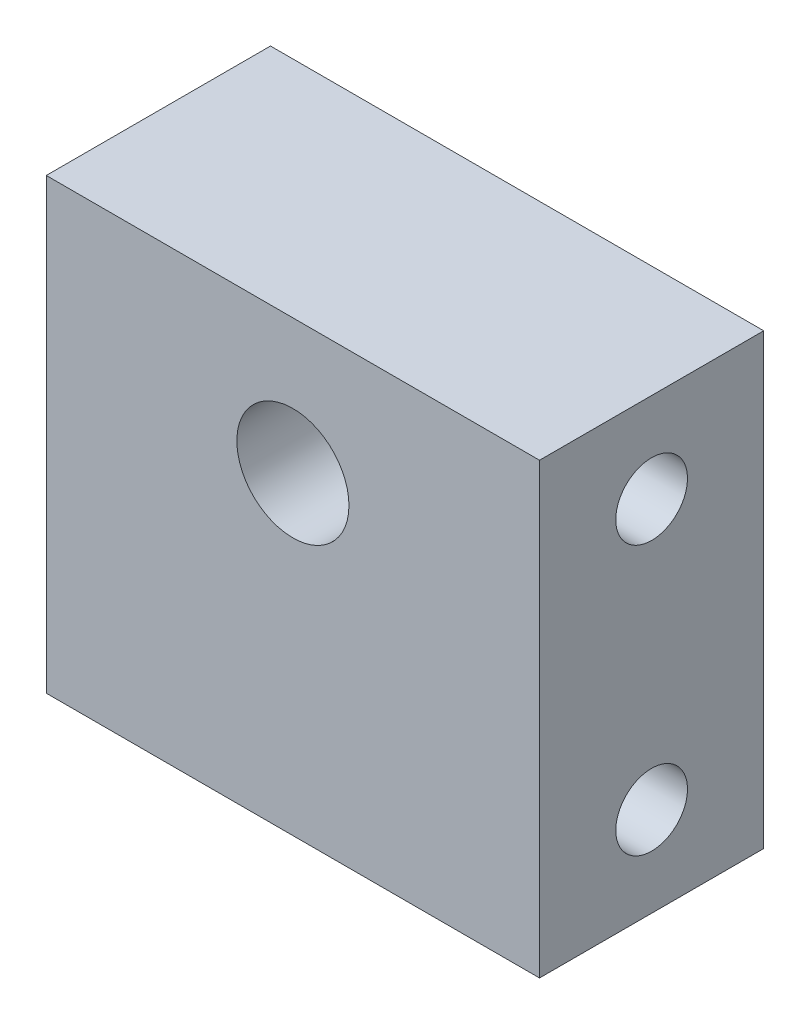
from build123d import *

# Parameters (mm, degrees)
ESQUISSE1_W                               = 11
ESQUISSE1_H                               = 10
BOSS_EXTRU_1_DEPTH                        = 5
TROU_POUR_TARAUDAGE_POUR_TROU_TARAUD_M2_D = 1.6
TROU_POUR_TARAUDAGE_POUR_TROU_TARAUD_M3_D = 2.5


with BuildPart() as part:
    # Esquisse1 → Boss.-Extru.1 (new body)
    with BuildSketch(Plane.XY):
        with Locations((5.5, 5)):
            Rectangle(ESQUISSE1_W, ESQUISSE1_H)
    extrude(amount=BOSS_EXTRU_1_DEPTH)

    # Trou pour taraudage pour trou taraudé M21 (through all)
    with Locations(Plane.ZY):
        with Locations((2.5, 8), (2.5, 2)):
            Hole(TROU_POUR_TARAUDAGE_POUR_TROU_TARAUD_M2_D / 2)

    # Trou pour taraudage pour trou taraudé M32 (through all)
    with Locations(Plane.XY.offset(5)):
        with Locations((5.5, 7)):
            Hole(TROU_POUR_TARAUDAGE_POUR_TROU_TARAUD_M3_D / 2)


solid = part.part
